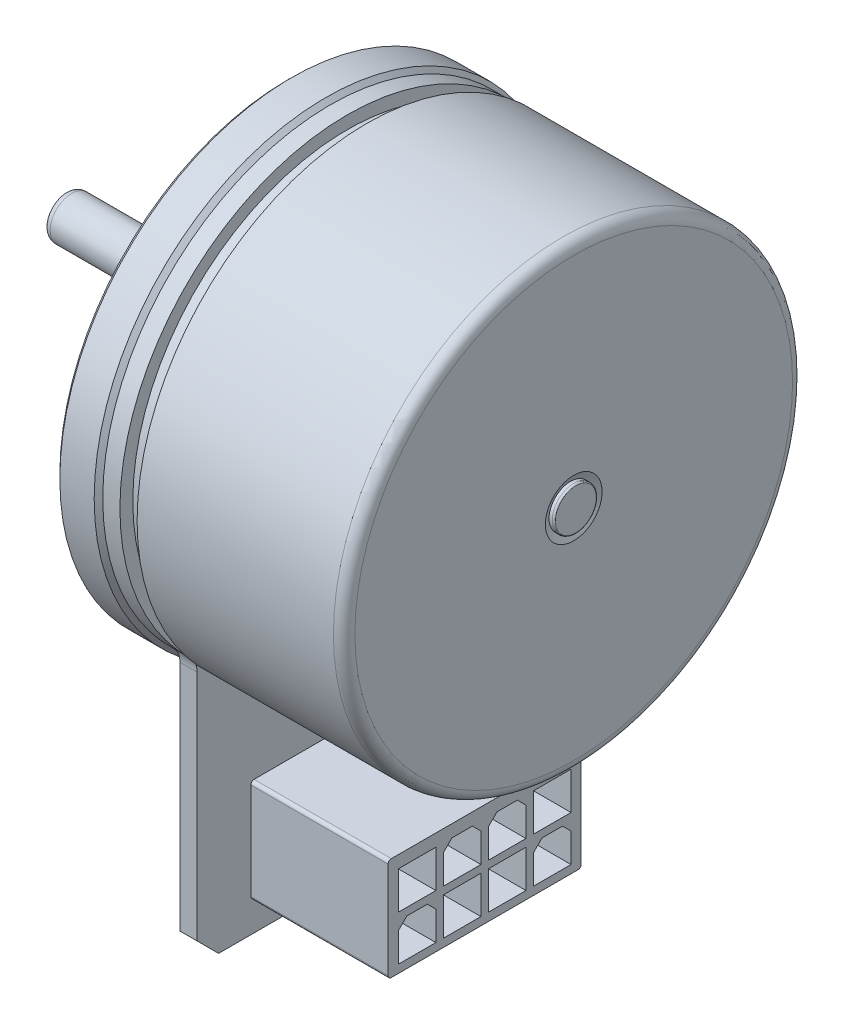
from build123d import *

# Parameters (mm, degrees)
BOSS_EXTRUDE1_START            = -22.7999999
BOSS_EXTRUDE1_OUTLINE_R        = 18.22
BOSS_EXTRUDE1_DEPTH            = 26.3999999
BOSS_EXTRUDE1_START_2          = -23.1
BOSS_EXTRUDE1_2_OUTLINE_R      = 21.4
BOSS_EXTRUDE1_2_OUTLINE_R_2    = 18.22
BOSS_EXTRUDE1_2_OUTLINE_R_3    = 2
BOSS_EXTRUDE1_2_DEPTH          = 19.3
BOSS_EXTRUDE1_START_3          = -12.8
BOSS_EXTRUDE1_3_OUTLINE_W      = 28
BOSS_EXTRUDE1_3_OUTLINE_H      = 11
BOSS_EXTRUDE1_3_DEPTH          = 12.4
BOSS_EXTRUDE1_START_4          = -1e-07
BOSS_EXTRUDE1_4_OUTLINE_R      = 21.6
BOSS_EXTRUDE1_4_OUTLINE_R_2    = 18.22
BOSS_EXTRUDE1_4_DEPTH          = 3.6000001
BOSS_EXTRUDE1_START_5          = -2
BOSS_EXTRUDE1_5_OUTLINE_R      = 18.22
BOSS_EXTRUDE1_5_DEPTH          = 1.6
BOSS_EXTRUDE1_START_6          = -3.15
BOSS_EXTRUDE1_6_OUTLINE_R      = 20
BOSS_EXTRUDE1_6_OUTLINE_R_2    = 18.22
BOSS_EXTRUDE1_6_DEPTH          = 6.75
BOSS_EXTRUDE1_START_7          = -14
BOSS_EXTRUDE1_7_DEPTH          = 28
BOSS_EXTRUDE1_8_OUTLINE_W      = 1.9
BOSS_EXTRUDE1_8_OUTLINE_H      = 0.2
BOSS_EXTRUDE1_8_OUTLINE_W_2    = 15.576647924
BOSS_EXTRUDE1_8_OUTLINE_H_2    = 0.3000001
BOSS_EXTRUDE1_8_OUTLINE_W_3    = 1.2
BOSS_EXTRUDE1_8_OUTLINE_H_3    = 0.3999999
SKETCH2_W                      = 28
SKETCH2_H                      = 1.4
CUT_EXTRUDE1_DEPTH             = 1.6
CUT_EXTRUDE2_DEPTH             = 5
CUT_EXTRUDE3_DEPTH             = 12.3
SKETCH5_W                      = 10.7
SKETCH5_H                      = 1.4
CUT_EXTRUDE4_DEPTH             = 9.8
CUT_EXTRUDE5_DEPTH             = 7.3
SKETCH7_W                      = 12.8
SKETCH7_H                      = 9.6
CUT_EXTRUDE6_DEPTH             = 5
SKETCH8_W                      = 1.6
SKETCH8_H                      = 28
BOSS_EXTRUDE2_DEPTH            = 2.8
SKETCH9_R                      = 1.099949424
BOSS_EXTRUDE3_DEPTH            = 0.6
BOSS_EXTRUDE3_TAPER            = 44.998682798
BOSS_EXTRUDE4_DEPTH            = 0.6
SKETCH11_R                     = 1.099949424
BOSS_EXTRUDE5_DEPTH            = 0.6
BOSS_EXTRUDE5_TAPER            = 44.998682798
BOSS_EXTRUDE6_DEPTH            = 0.6
SKETCH13_R                     = 1.099949424
BOSS_EXTRUDE7_DEPTH            = 0.6
BOSS_EXTRUDE7_TAPER            = 44.998682798
BOSS_EXTRUDE8_DEPTH            = 0.6
SKETCH15_R                     = 1.099949424
BOSS_EXTRUDE9_DEPTH            = 0.6
BOSS_EXTRUDE9_TAPER            = 44.998682798
BOSS_EXTRUDE10_DEPTH           = 0.6
SKETCH17_R                     = 1.099949424
BOSS_EXTRUDE11_DEPTH           = 0.6
BOSS_EXTRUDE11_TAPER           = 44.998682798
BOSS_EXTRUDE12_DEPTH           = 0.6
SKETCH19_R                     = 1.099949424
BOSS_EXTRUDE13_DEPTH           = 0.6
BOSS_EXTRUDE13_TAPER           = 44.998682798
BOSS_EXTRUDE14_DEPTH           = 0.6
SKETCH21_R                     = 1.099949424
BOSS_EXTRUDE15_DEPTH           = 0.6
BOSS_EXTRUDE15_TAPER           = 44.998682798
BOSS_EXTRUDE16_DEPTH           = 0.6
SKETCH23_R                     = 1.099949424
BOSS_EXTRUDE17_DEPTH           = 0.6
BOSS_EXTRUDE17_TAPER           = 44.998682798
BOSS_EXTRUDE18_DEPTH           = 0.6
SKETCH25_W                     = 3.5
SKETCH25_H                     = 3.5
CUT_EXTRUDE7_DEPTH             = 10
SKETCH26_W                     = 0.969786262
SKETCH26_H                     = 0.969786262
BOSS_EXTRUDE19_DEPTH           = 5
SKETCH27_W                     = 3.5
SKETCH27_H                     = 3.5
CUT_EXTRUDE8_DEPTH             = 10
SKETCH28_W                     = 0.969786262
SKETCH28_H                     = 0.969786262
BOSS_EXTRUDE20_DEPTH           = 5
SKETCH29_W                     = 3.5
SKETCH29_H                     = 3.5
CUT_EXTRUDE9_DEPTH             = 10
SKETCH30_W                     = 0.969786262
SKETCH30_H                     = 0.969786262
BOSS_EXTRUDE21_DEPTH           = 5
SKETCH31_W                     = 3.5
SKETCH31_H                     = 3.5
CUT_EXTRUDE10_DEPTH            = 10
SKETCH32_W                     = 0.969786262
SKETCH32_H                     = 0.969786262
BOSS_EXTRUDE22_DEPTH           = 5
SKETCH33_W                     = 3.5
SKETCH33_H                     = 3.5
CUT_EXTRUDE11_DEPTH            = 10
SKETCH34_W                     = 0.969786262
SKETCH34_H                     = 0.969786262
BOSS_EXTRUDE23_DEPTH           = 5
SKETCH35_W                     = 3.5
SKETCH35_H                     = 3.5
CUT_EXTRUDE12_DEPTH            = 10
SKETCH36_W                     = 0.969786262
SKETCH36_H                     = 0.969786262
BOSS_EXTRUDE24_DEPTH           = 5
SKETCH37_W                     = 3.5
SKETCH37_H                     = 3.5
CUT_EXTRUDE13_DEPTH            = 10
SKETCH38_W                     = 0.969786262
SKETCH38_H                     = 0.969786262
BOSS_EXTRUDE25_DEPTH           = 5
SKETCH39_W                     = 3.5
SKETCH39_H                     = 3.5
CUT_EXTRUDE14_DEPTH            = 10
SKETCH40_W                     = 0.969786262
SKETCH40_H                     = 0.969786262
BOSS_EXTRUDE26_DEPTH           = 5
SKETCH41_R                     = 6
BOSS_EXTRUDE27_DEPTH           = 3.2
SKETCH44_R                     = 2
BOSS_EXTRUDE28_DEPTH           = 17.6
THICKEN1_OUTLINE_W             = 1.73
THICKEN1_OUTLINE_H             = 0.5
F_2_5_2_5_DIAMETER_HOLE1_D     = 2.5
F_2_5_2_5_DIAMETER_HOLE1_DEPTH = 6.1
F_2_5_2_5_DIAMETER_HOLE1_TIP   = 0.751075774
CHAMFER1_SIZE                  = 0.8
CHAMFER2_SIZE                  = 0.080384758
CHAMFER2_SIZE2                 = 0.3
CHAMFER3_SIZE                  = 0.4
CHAMFER4_SIZE                  = 2
FILLET1_R                      = 0.3
FILLET2_R                      = 1
FILLET3_R                      = 2


with BuildPart() as part:
    # Boss-Extrude1: read off the stored shape, not the designer's step
    # Boss-Extrude1 outline → Boss-Extrude1 (new body)
    with BuildSketch(Plane.ZY.offset(-3.6).offset(BOSS_EXTRUDE1_START)):
        Circle(BOSS_EXTRUDE1_OUTLINE_R)
    extrude(amount=BOSS_EXTRUDE1_DEPTH)

    # Boss-Extrude1 2 outline → Boss-Extrude1 2 (add)
    # profile 1 of 2: a face of its own
    with BuildSketch(Plane.ZY.offset(-3.6).offset(BOSS_EXTRUDE1_START_2)):
        Circle(BOSS_EXTRUDE1_2_OUTLINE_R)
        Circle(BOSS_EXTRUDE1_2_OUTLINE_R_2, mode=Mode.SUBTRACT)
    # profile 2 of 2: a face of its own
    with BuildSketch(Plane.ZY.offset(-3.6).offset(BOSS_EXTRUDE1_START_2)):
        Circle(BOSS_EXTRUDE1_2_OUTLINE_R_3)
    extrude(amount=BOSS_EXTRUDE1_2_DEPTH)

    # Boss-Extrude1 4 outline → Boss-Extrude1 4 (add)
    with BuildSketch(Plane.ZY.offset(-3.6).offset(BOSS_EXTRUDE1_START_4)):
        Circle(BOSS_EXTRUDE1_4_OUTLINE_R)
        Circle(BOSS_EXTRUDE1_4_OUTLINE_R_2, mode=Mode.SUBTRACT)
    extrude(amount=BOSS_EXTRUDE1_4_DEPTH)



with BuildPart() as body_2:
    # Boss-Extrude1 3 outline → Boss-Extrude1 3 (new body)
    with BuildSketch(Plane.ZY.offset(-3.6).offset(BOSS_EXTRUDE1_START_3)):
        with Locations((0, -33.6)):
            Rectangle(BOSS_EXTRUDE1_3_OUTLINE_W, BOSS_EXTRUDE1_3_OUTLINE_H)
    extrude(amount=BOSS_EXTRUDE1_3_DEPTH)


with BuildPart() as part_1:
    add(part.part)

    add(body_2.part)  # Boss-Extrude1 5 merges body 2
    # Boss-Extrude1 5 outline → Boss-Extrude1 5 (add)
    with BuildSketch(Plane.ZY.offset(-3.6).offset(BOSS_EXTRUDE1_START_5)):
        with BuildLine():
            Line((-14, -28.1), (14, -28.1))
            Line((14, -28.1), (14, -15.919798994))
            ThreePointArc((14, -15.919798994), (0, 21.2), (-14, -15.919798994))
            Line((-14, -15.919798994), (-14, -28.1))
        make_face()
        Circle(BOSS_EXTRUDE1_5_OUTLINE_R, mode=Mode.SUBTRACT)
    extrude(amount=BOSS_EXTRUDE1_5_DEPTH)

    # Boss-Extrude1 6 outline → Boss-Extrude1 6 (add)
    with BuildSketch(Plane.ZY.offset(-3.6).offset(BOSS_EXTRUDE1_START_6)):
        Circle(BOSS_EXTRUDE1_6_OUTLINE_R)
        Circle(BOSS_EXTRUDE1_6_OUTLINE_R_2, mode=Mode.SUBTRACT)
    extrude(amount=BOSS_EXTRUDE1_6_DEPTH)

    # Boss-Extrude1 7 outline → Boss-Extrude1 7 (add)
    with BuildSketch(Plane.XY.offset(BOSS_EXTRUDE1_START_7)):
        Polygon((16.4, -28.1), (16.4, -39.1), (18.4, -37.7), (18.4, -28.1), align=None)
    extrude(amount=BOSS_EXTRUDE1_7_DEPTH)

    # Boss-Extrude1 8 outline → Boss-Extrude1 8 (revolve)
    with BuildSketch(Plane.YX):
        with BuildLine():
            Line((2, 26.784660313), (2, 26.7))
            add(Edge.make_bspline(
                [(2, 26.7), (2.005297596, 26.732729171), (2.004701657, 26.76044204), (2, 26.784660313)],
                knots=[0, 0, 0, 0, 0.296933573, 0.296933573, 0.296933573, 0.296933573], degree=3))
        make_face()
        with BuildLine():
            Line((1.9, 26.7), (2, 26.7))
            Line((2, 26.7), (2, 26.784660313))
            add(Edge.make_bspline(
                [(2, 26.784660313), (1.996784639, 26.801222665), (1.985326561, 26.834528812), (1.957130123, 26.87734766), (1.927914609, 26.9), (1.9, 26.9)],
                knots=[0.296933573, 0.296933573, 0.296933573, 0.296933573, 0.5, 0.75, 1, 1, 1, 1], degree=3))
            Line((1.9, 26.9), (1.9, 26.7))
        make_face()
        with Locations((0.95, 26.8)):
            Rectangle(BOSS_EXTRUDE1_8_OUTLINE_W, BOSS_EXTRUDE1_8_OUTLINE_H)
        Polygon((2.643352076, 26.3999999), (2.643352076, 26.7), (2, 26.4), align=None)
        with Locations((10.431676038, 26.54999995)):
            Rectangle(BOSS_EXTRUDE1_8_OUTLINE_W_2, BOSS_EXTRUDE1_8_OUTLINE_H_2)
        with Locations((20.6, 3.80000005)):
            Rectangle(BOSS_EXTRUDE1_8_OUTLINE_W_3, BOSS_EXTRUDE1_8_OUTLINE_H_3)
        Polygon((21.6, 3.6), (21.2, 4), (21.2, 3.6), align=None)
    revolve(axis=Axis((0, 0, 0), (1, 0, 0)))

    # Sketch2 → Cut-Extrude1 (cut)
    with BuildSketch(Plane.ZY.offset(-4)):
        with Locations((0, -38.4)):
            Rectangle(SKETCH2_W, SKETCH2_H)
    extrude(amount=-CUT_EXTRUDE1_DEPTH, mode=Mode.SUBTRACT)

    # Sketch3 → Cut-Extrude2 (cut)
    with BuildSketch(Plane(origin=(0, 0, -14), x_dir=(-1, 0, 0), z_dir=(0, 0, -1))):
        Polygon((-16.4, -39.1), (-5.6, -39.1), (-5.6, -37.7), (-5.6, -28.1), (-18.4, -28.1), (-18.4, -37.7), align=None)
    extrude(amount=-CUT_EXTRUDE2_DEPTH, mode=Mode.SUBTRACT)

    # Sketch4 → Cut-Extrude3 (cut)
    with BuildSketch(Plane.XY.offset(14)):
        Polygon((16.4, -39.1), (18.4, -37.7), (5.6, -37.7), (5.6, -39.1), align=None)
    extrude(amount=-CUT_EXTRUDE3_DEPTH, mode=Mode.SUBTRACT)

    # Sketch5 → Cut-Extrude4 (cut)
    with BuildSketch(Plane.ZY.offset(-5.6)):
        with Locations((-3.65, -38.4)):
            Rectangle(SKETCH5_W, SKETCH5_H)
    extrude(amount=-CUT_EXTRUDE4_DEPTH, mode=Mode.SUBTRACT)

    # Sketch6 → Cut-Extrude5 (cut)
    with BuildSketch(Plane(origin=(0, 0, -9), x_dir=(-1, 0, 0), z_dir=(0, 0, -1))):
        Polygon((-16.4, -39.1), (-15.4, -39.1), (-15.4, -37.7), (-18.4, -37.7), align=None)
    extrude(amount=-CUT_EXTRUDE5_DEPTH, mode=Mode.SUBTRACT)

    # Sketch7 → Cut-Extrude6 (cut)
    with BuildSketch(Plane.XY.offset(14)):
        with Locations((12, -32.9)):
            Rectangle(SKETCH7_W, SKETCH7_H)
    extrude(amount=-CUT_EXTRUDE6_DEPTH, mode=Mode.SUBTRACT)

    # Sketch8 → Boss-Extrude2 (add)
    with BuildSketch(Plane.XZ.offset(37.7)):
        with Locations((4.8, 0)):
            Rectangle(SKETCH8_W, SKETCH8_H)
    extrude(amount=BOSS_EXTRUDE2_DEPTH)

    # Sketch9 → Boss-Extrude3 (add)
    with BuildSketch(Plane.ZY.offset(-4)):
        with Locations((-6.3, -31)):
            Circle(SKETCH9_R)
    extrude(amount=BOSS_EXTRUDE3_DEPTH, taper=BOSS_EXTRUDE3_TAPER)

    # Sketch10 → Boss-Extrude4 (add)
    with BuildSketch(Plane.XY.offset(-6)):
        Polygon((2.1, -30.7), (2.1, -30.8), (3.1, -31.3), (3.4, -31.3), (3.4, -30.7), align=None)
    extrude(amount=-BOSS_EXTRUDE4_DEPTH)

    # Sketch11 → Boss-Extrude5 (add)
    with BuildSketch(Plane.ZY.offset(-4)):
        with Locations((-2.1, -31)):
            Circle(SKETCH11_R)
    extrude(amount=BOSS_EXTRUDE5_DEPTH, taper=BOSS_EXTRUDE5_TAPER)

    # Sketch12 → Boss-Extrude6 (add)
    with BuildSketch(Plane.XY.offset(-1.8)):
        Polygon((2.1, -30.7), (2.1, -30.8), (3.1, -31.3), (3.4, -31.3), (3.4, -30.7), align=None)
    extrude(amount=-BOSS_EXTRUDE6_DEPTH)

    # Sketch13 → Boss-Extrude7 (add)
    with BuildSketch(Plane.ZY.offset(-4)):
        with Locations((2.1, -31)):
            Circle(SKETCH13_R)
    extrude(amount=BOSS_EXTRUDE7_DEPTH, taper=BOSS_EXTRUDE7_TAPER)

    # Sketch14 → Boss-Extrude8 (add)
    with BuildSketch(Plane.XY.offset(2.4)):
        Polygon((2.1, -30.7), (2.1, -30.8), (3.1, -31.3), (3.4, -31.3), (3.4, -30.7), align=None)
    extrude(amount=-BOSS_EXTRUDE8_DEPTH)

    # Sketch15 → Boss-Extrude9 (add)
    with BuildSketch(Plane.ZY.offset(-4)):
        with Locations((6.3, -31)):
            Circle(SKETCH15_R)
    extrude(amount=BOSS_EXTRUDE9_DEPTH, taper=BOSS_EXTRUDE9_TAPER)

    # Sketch16 → Boss-Extrude10 (add)
    with BuildSketch(Plane.XY.offset(6.6)):
        Polygon((2.1, -30.7), (2.1, -30.8), (3.1, -31.3), (3.4, -31.3), (3.4, -30.7), align=None)
    extrude(amount=-BOSS_EXTRUDE10_DEPTH)

    # Sketch17 → Boss-Extrude11 (add)
    with BuildSketch(Plane.ZY.offset(-4)):
        with Locations((-6.3, -35.2)):
            Circle(SKETCH17_R)
    extrude(amount=BOSS_EXTRUDE11_DEPTH, taper=BOSS_EXTRUDE11_TAPER)

    # Sketch18 → Boss-Extrude12 (add)
    with BuildSketch(Plane.XY.offset(-6)):
        Polygon((3.4, -34.9), (3.1, -34.9), (2.1, -35.4), (2.1, -35.5), (3.4, -35.5), align=None)
    extrude(amount=-BOSS_EXTRUDE12_DEPTH)

    # Sketch19 → Boss-Extrude13 (add)
    with BuildSketch(Plane.ZY.offset(-4)):
        with Locations((-2.1, -35.2)):
            Circle(SKETCH19_R)
    extrude(amount=BOSS_EXTRUDE13_DEPTH, taper=BOSS_EXTRUDE13_TAPER)

    # Sketch20 → Boss-Extrude14 (add)
    with BuildSketch(Plane.XY.offset(-1.8)):
        Polygon((3.4, -34.9), (3.1, -34.9), (2.1, -35.4), (2.1, -35.5), (3.4, -35.5), align=None)
    extrude(amount=-BOSS_EXTRUDE14_DEPTH)

    # Sketch21 → Boss-Extrude15 (add)
    with BuildSketch(Plane.ZY.offset(-4)):
        with Locations((2.1, -35.2)):
            Circle(SKETCH21_R)
    extrude(amount=BOSS_EXTRUDE15_DEPTH, taper=BOSS_EXTRUDE15_TAPER)

    # Sketch22 → Boss-Extrude16 (add)
    with BuildSketch(Plane.XY.offset(2.4)):
        Polygon((3.4, -34.9), (3.1, -34.9), (2.1, -35.4), (2.1, -35.5), (3.4, -35.5), align=None)
    extrude(amount=-BOSS_EXTRUDE16_DEPTH)

    # Sketch23 → Boss-Extrude17 (add)
    with BuildSketch(Plane.ZY.offset(-4)):
        with Locations((6.3, -35.2)):
            Circle(SKETCH23_R)
    extrude(amount=BOSS_EXTRUDE17_DEPTH, taper=BOSS_EXTRUDE17_TAPER)

    # Sketch24 → Boss-Extrude18 (add)
    with BuildSketch(Plane.XY.offset(6.6)):
        Polygon((3.4, -34.9), (3.1, -34.9), (2.1, -35.4), (2.1, -35.5), (3.4, -35.5), align=None)
    extrude(amount=-BOSS_EXTRUDE18_DEPTH)

    # Sketch25 → Cut-Extrude7 (cut)
    with BuildSketch(Plane(origin=(18.4, 0, 0), x_dir=(0, 0, -1), z_dir=(1, 0, 0))):
        with Locations((6.3, -31)):
            Rectangle(SKETCH25_W, SKETCH25_H)
    extrude(amount=-CUT_EXTRUDE7_DEPTH, mode=Mode.SUBTRACT)

    # Sketch26 → Boss-Extrude19 (add)
    with BuildSketch(Plane(origin=(8.4, 0, 0), x_dir=(0, 0, -1), z_dir=(1, 0, 0))):
        with Locations((6.3, -31)):
            Rectangle(SKETCH26_W, SKETCH26_H)
    extrude(amount=BOSS_EXTRUDE19_DEPTH)

    # Sketch27 → Cut-Extrude8 (cut)
    with BuildSketch(Plane(origin=(18.4, 0, 0), x_dir=(0, 0, -1), z_dir=(1, 0, 0))):
        with Locations((-2.1, -35.2)):
            Rectangle(SKETCH27_W, SKETCH27_H)
    extrude(amount=-CUT_EXTRUDE8_DEPTH, mode=Mode.SUBTRACT)

    # Sketch28 → Boss-Extrude20 (add)
    with BuildSketch(Plane(origin=(8.4, 0, 0), x_dir=(0, 0, -1), z_dir=(1, 0, 0))):
        with Locations((-2.1, -35.2)):
            Rectangle(SKETCH28_W, SKETCH28_H)
    extrude(amount=BOSS_EXTRUDE20_DEPTH)

    # Sketch29 → Cut-Extrude9 (cut)
    with BuildSketch(Plane(origin=(18.4, 0, 0), x_dir=(0, 0, -1), z_dir=(1, 0, 0))):
        with Locations((2.1, -35.2)):
            Rectangle(SKETCH29_W, SKETCH29_H)
    extrude(amount=-CUT_EXTRUDE9_DEPTH, mode=Mode.SUBTRACT)

    # Sketch30 → Boss-Extrude21 (add)
    with BuildSketch(Plane(origin=(8.4, 0, 0), x_dir=(0, 0, -1), z_dir=(1, 0, 0))):
        with Locations((2.1, -35.2)):
            Rectangle(SKETCH30_W, SKETCH30_H)
    extrude(amount=BOSS_EXTRUDE21_DEPTH)

    # Sketch31 → Cut-Extrude10 (cut)
    with BuildSketch(Plane(origin=(18.4, 0, 0), x_dir=(0, 0, -1), z_dir=(1, 0, 0))):
        with Locations((-2.1, -31)):
            Rectangle(SKETCH31_W, SKETCH31_H)
    extrude(amount=-CUT_EXTRUDE10_DEPTH, mode=Mode.SUBTRACT)

    # Sketch32 → Boss-Extrude22 (add)
    with BuildSketch(Plane(origin=(8.4, 0, 0), x_dir=(0, 0, -1), z_dir=(1, 0, 0))):
        with Locations((-2.1, -31)):
            Rectangle(SKETCH32_W, SKETCH32_H)
    extrude(amount=BOSS_EXTRUDE22_DEPTH)

    # Sketch33 → Cut-Extrude11 (cut)
    with BuildSketch(Plane(origin=(18.4, 0, 0), x_dir=(0, 0, -1), z_dir=(1, 0, 0))):
        with Locations((2.1, -31)):
            Rectangle(SKETCH33_W, SKETCH33_H)
    extrude(amount=-CUT_EXTRUDE11_DEPTH, mode=Mode.SUBTRACT)

    # Sketch34 → Boss-Extrude23 (add)
    with BuildSketch(Plane(origin=(8.4, 0, 0), x_dir=(0, 0, -1), z_dir=(1, 0, 0))):
        with Locations((2.1, -31)):
            Rectangle(SKETCH34_W, SKETCH34_H)
    extrude(amount=BOSS_EXTRUDE23_DEPTH)

    # Sketch35 → Cut-Extrude12 (cut)
    with BuildSketch(Plane(origin=(18.4, 0, 0), x_dir=(0, 0, -1), z_dir=(1, 0, 0))):
        with Locations((6.3, -35.2)):
            Rectangle(SKETCH35_W, SKETCH35_H)
    extrude(amount=-CUT_EXTRUDE12_DEPTH, mode=Mode.SUBTRACT)

    # Sketch36 → Boss-Extrude24 (add)
    with BuildSketch(Plane(origin=(8.4, 0, 0), x_dir=(0, 0, -1), z_dir=(1, 0, 0))):
        with Locations((6.3, -35.2)):
            Rectangle(SKETCH36_W, SKETCH36_H)
    extrude(amount=BOSS_EXTRUDE24_DEPTH)

    # Sketch37 → Cut-Extrude13 (cut)
    with BuildSketch(Plane(origin=(18.4, 0, 0), x_dir=(0, 0, -1), z_dir=(1, 0, 0))):
        with Locations((-6.3, -35.2)):
            Rectangle(SKETCH37_W, SKETCH37_H)
    extrude(amount=-CUT_EXTRUDE13_DEPTH, mode=Mode.SUBTRACT)

    # Sketch38 → Boss-Extrude25 (add)
    with BuildSketch(Plane(origin=(8.4, 0, 0), x_dir=(0, 0, -1), z_dir=(1, 0, 0))):
        with Locations((-6.3, -35.2)):
            Rectangle(SKETCH38_W, SKETCH38_H)
    extrude(amount=BOSS_EXTRUDE25_DEPTH)

    # Sketch39 → Cut-Extrude14 (cut)
    with BuildSketch(Plane(origin=(18.4, 0, 0), x_dir=(0, 0, -1), z_dir=(1, 0, 0))):
        with Locations((-6.3, -31)):
            Rectangle(SKETCH39_W, SKETCH39_H)
    extrude(amount=-CUT_EXTRUDE14_DEPTH, mode=Mode.SUBTRACT)

    # Sketch40 → Boss-Extrude26 (add)
    with BuildSketch(Plane(origin=(8.4, 0, 0), x_dir=(0, 0, -1), z_dir=(1, 0, 0))):
        with Locations((-6.3, -31)):
            Rectangle(SKETCH40_W, SKETCH40_H)
    extrude(amount=BOSS_EXTRUDE26_DEPTH)

    # Sketch41 → Boss-Extrude27 (add)
    with BuildSketch(Plane.ZY):
        Circle(SKETCH41_R)
    extrude(amount=BOSS_EXTRUDE27_DEPTH)

    # Sketch42 → Ø8.0 (8) Diameter Hole1 (revolve, cut)
    with BuildSketch(Plane(origin=(-3.2, 0, 0), x_dir=(0, 0, 1), z_dir=(0, 1, 0))):
        Polygon((0, 0), (0, 0.7), (4, 0.7), (4, 0.4), (4.692820323, 0), align=None)
    revolve(axis=Axis((-9.55, 0, 0), (1, 0, 0)), mode=Mode.SUBTRACT)

    # Sketch44 → Boss-Extrude28 (add)
    with BuildSketch(Plane.ZY.offset(2.5)):
        Circle(SKETCH44_R)
    extrude(amount=BOSS_EXTRUDE28_DEPTH)

    # Thicken1: read off the stored shape, not the designer's step
    # Thicken1 outline → Thicken1 (revolve)
    with BuildSketch(Plane.YX):
        with BuildLine():
            Line((1.73, -20.1), (1.73, -20.6))
            add(Edge.make_bspline(
                [(1.73, -20.6), (1.794166667, -20.6), (1.865568194, -20.543068194), (1.966710597, -20.387543931), (2, -20.228333333), (2, -20.1)],
                knots=[0, 0, 0, 0, 0.25, 0.5, 1, 1, 1, 1], degree=3))
            Line((2, -20.1), (1.73, -20.1))
        make_face()
        with Locations((0.865, -20.35)):
            Rectangle(THICKEN1_OUTLINE_W, THICKEN1_OUTLINE_H)
    revolve(axis=Axis((0, 0, 0), (1, 0, 0)))

    # Ø2.5 (2.5) Diameter Hole1
    with Locations(Plane.ZY):
        with Locations((0, 11), (-9.526279442, -5.5), (9.526279442, -5.5)):
            Hole(F_2_5_2_5_DIAMETER_HOLE1_D / 2, depth=F_2_5_2_5_DIAMETER_HOLE1_DEPTH)
            with Locations((0, 0, -(F_2_5_2_5_DIAMETER_HOLE1_DEPTH + F_2_5_2_5_DIAMETER_HOLE1_TIP / 2))):  # 118° drill point
                Cone(0, F_2_5_2_5_DIAMETER_HOLE1_D / 2, F_2_5_2_5_DIAMETER_HOLE1_TIP, mode=Mode.SUBTRACT)

    # Chamfer1
    chamfer1_edges = [part_1.edges().sort_by_distance(p)[0] for p in [
        (13.4, -29.25, 3.85),
        (13.4, -29.25, 0.35),
        (13.4, -29.25, -0.35),
        (13.4, -29.25, -3.85),
        (13.4, -33.45, -4.55),
        (13.4, -33.45, -8.05),
        (13.4, -33.45, 8.05),
        (13.4, -33.45, 4.55),
    ]]
    chamfer(chamfer1_edges, length=CHAMFER1_SIZE)

    # Chamfer2
    chamfer2_edges = [part_1.edges().sort_by_distance(p)[0] for p in [
        (-3.2, 0, -6),
    ]]
    chamfer2_side = [part_1.faces().sort_by_distance(p)[0] for p in [
        (-3.2, 0, -5.830294373),
    ]]
    chamfer(chamfer2_edges, length=CHAMFER2_SIZE, length2=CHAMFER2_SIZE2, reference=chamfer2_side[0])

    # Chamfer3
    chamfer3_edges = [part_1.edges().sort_by_distance(p)[0] for p in [
        (0, 0, -21.6),
    ]]
    chamfer(chamfer3_edges, length=CHAMFER3_SIZE)

    # Chamfer4
    chamfer4_edges = [part_1.edges().sort_by_distance(p)[0] for p in [
        (4.8, -40.5, 14),
        (4.8, -40.5, -14),
    ]]
    chamfer(chamfer4_edges, length=CHAMFER4_SIZE)

    # Fillet1
    fillet1_edges = [part_1.edges().sort_by_distance(p)[0] for p in [
        (12, -28.1, -9),
        (12, -37.7, -9),
        (12, -37.7, 9),
        (12, -28.1, 9),
    ]]
    fillet(fillet1_edges, radius=FILLET1_R)

    # Fillet2
    fillet2_edges = [part_1.edges().sort_by_distance(p)[0] for p in [
        (26.7, 0, -21.4),
    ]]
    fillet(fillet2_edges, radius=FILLET2_R)

    # Fillet3
    fillet3_edges = [part_1.edges().sort_by_distance(p)[0] for p in [
        (4.8, -15.919798994, -14),
        (4.8, -15.919798994, 14),
    ]]
    fillet(fillet3_edges, radius=FILLET3_R)


solid = part_1.part
